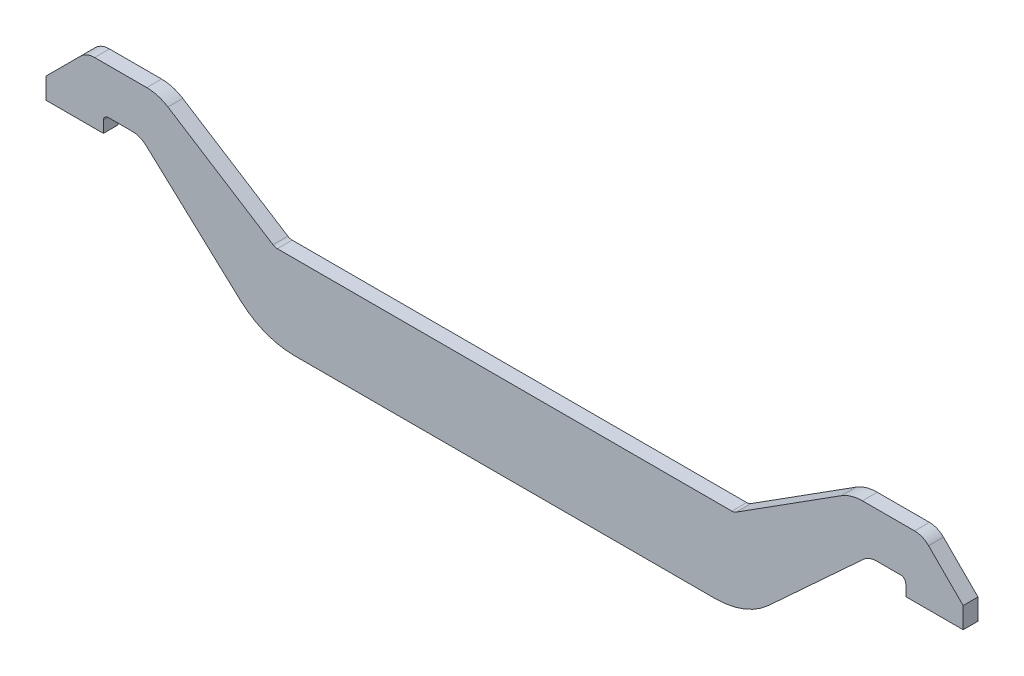
from build123d import *

# Parameters (mm, degrees)
BOSS_EXTRUDE1_DEPTH = 4.7625
F_1_0_RADIUS_R      = 25.4
F_0_1_RADIUS_R      = 2.54
F_0_25_RADIUS_R     = 6.35
F_0_5_RADIUS_R      = 12.7
F_0_0625_RADIUS_R   = 1.5875


with BuildPart() as part:
    # Sketch1 → Boss-Extrude1 (new body)
    with BuildSketch(Plane.XY):
        Polygon((0, 0), (154.94, 0), (194.3735, 36.322), (206.1845, 36.322), (206.1845, 31.115), (224.5995, 31.115), (224.5995, 37.846), (211.6455, 50.8), (188.595, 50.8), (151.13, 26.9875), (3.81, 26.9875), (-33.655, 50.8), (-56.7055, 50.8), (-69.6595, 37.846), (-69.6595, 36.322), (-69.6595, 31.115), (-51.2445, 31.115), (-51.2445, 36.322), (-39.4335, 36.322), align=None)
    extrude(amount=BOSS_EXTRUDE1_DEPTH)

    # 1.0 Radius
    f_1_0_radius_edges = [part.edges().sort_by_distance(p)[0] for p in [
        (0, 0, 2.38125),
        (154.94, 0, 2.38125),
    ]]
    fillet(f_1_0_radius_edges, radius=F_1_0_RADIUS_R)

    # 0.1 Radius
    f_0_1_radius_edges = [part.edges().sort_by_distance(p)[0] for p in [
        (3.81, 26.9875, 2.38125),
        (151.13, 26.9875, 2.38125),
    ]]
    fillet(f_0_1_radius_edges, radius=F_0_1_RADIUS_R)

    # 0.25 Radius
    f_0_25_radius_edges = [part.edges().sort_by_distance(p)[0] for p in [
        (194.3735, 36.322, 2.38125),
        (-39.4335, 36.322, 2.38125),
        (-56.7055, 50.8, 2.38125),
        (211.6455, 50.8, 2.38125),
    ]]
    fillet(f_0_25_radius_edges, radius=F_0_25_RADIUS_R)

    # 0.5 Radius
    f_0_5_radius_edges = [part.edges().sort_by_distance(p)[0] for p in [
        (-33.655, 50.8, 2.38125),
        (188.595, 50.8, 2.38125),
    ]]
    fillet(f_0_5_radius_edges, radius=F_0_5_RADIUS_R)

    # 0.0625 Radius
    f_0_0625_radius_edges = [part.edges().sort_by_distance(p)[0] for p in [
        (206.1845, 36.322, 2.38125),
        (-51.2445, 36.322, 2.38125),
    ]]
    fillet(f_0_0625_radius_edges, radius=F_0_0625_RADIUS_R)


solid = part.part
